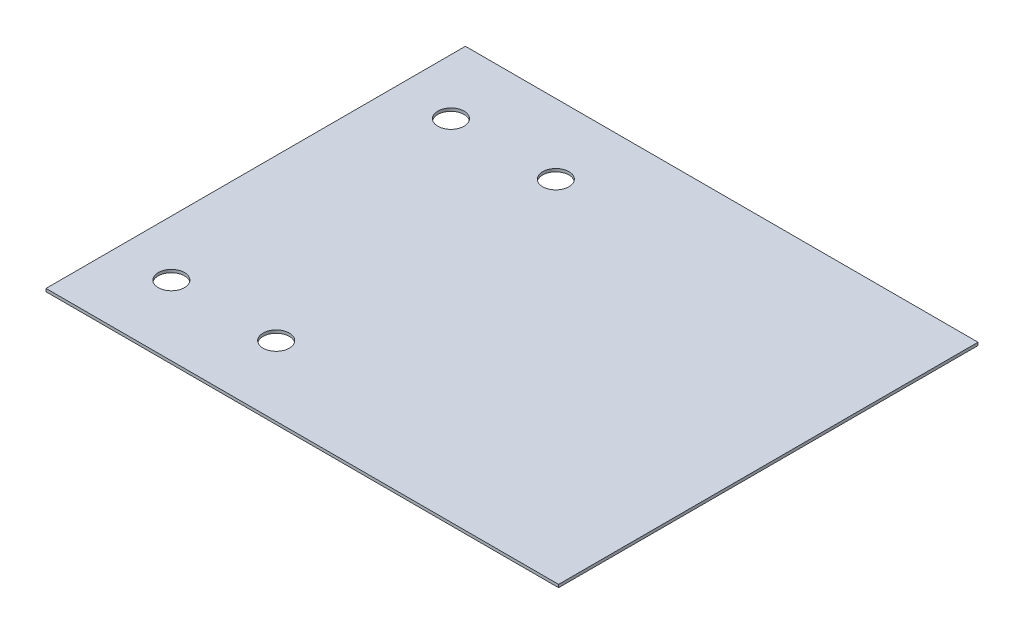
from build123d import *

# Parameters (mm, degrees)
SKETCH1_W           = 558.8
SKETCH1_H           = 457.2
BOSS_EXTRUDE1_DEPTH = 3.175
SKETCH2_R           = 14.2875
CUT_EXTRUDE1_DEPTH  = 3.175


with BuildPart() as part:
    # Sketch1 → Boss-Extrude1 (new body)
    with BuildSketch(Plane(origin=(0, 0, 0), x_dir=(1, 0, 0), z_dir=(0, 1, 0))):
        with Locations((279.4, 228.6)):
            Rectangle(SKETCH1_W, SKETCH1_H)
    extrude(amount=BOSS_EXTRUDE1_DEPTH)

    # Sketch2 → Cut-Extrude1 (cut)
    with BuildSketch(Plane(origin=(0, 3.175, 0), x_dir=(1, 0, 0), z_dir=(0, 1, 0))):
        with Locations((60.460569695, 381)):
            Circle(SKETCH2_R)
        with Locations((174.760569695, 381)):
            Circle(SKETCH2_R)
        with Locations((60.460569695, 76.2)):
            Circle(SKETCH2_R)
        with Locations((174.760569695, 76.2)):
            Circle(SKETCH2_R)
    extrude(amount=-CUT_EXTRUDE1_DEPTH, mode=Mode.SUBTRACT)


solid = part.part
